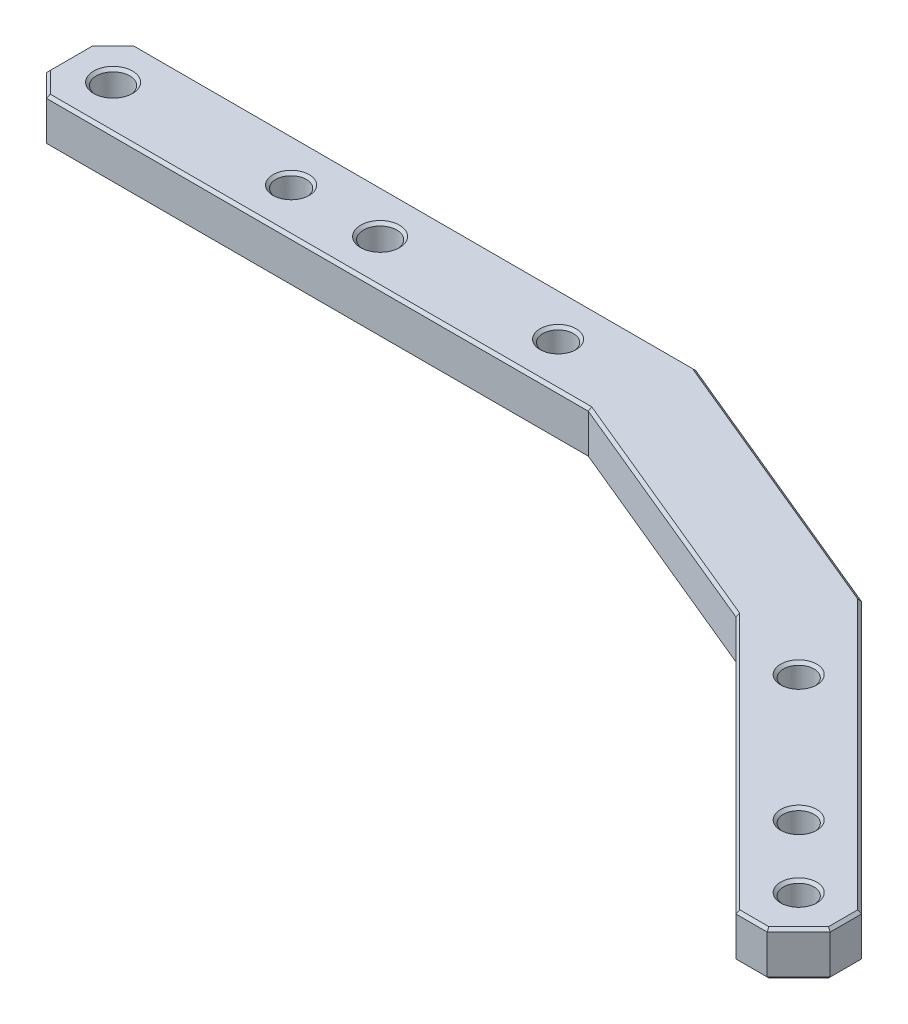
from build123d import *

# Parameters (mm, degrees)
SKETCH1_R           = 2.38125
SKETCH1_R_2         = 2.1828125
BOSS_EXTRUDE1_DEPTH = 6.35
CHAMFER1_SIZE       = 3.175
CHAMFER2_SIZE       = 0.396875


with BuildPart() as part:
    # Sketch1 → Boss-Extrude1 (new body)
    with BuildSketch(Plane(origin=(0, 0, 0), x_dir=(1, 0, 0), z_dir=(0, 1, 0))):
        Polygon((-44.45, 6.35), (62.365403734, 6.35), (119.934787808, -51.219384074), (110.954531687, -60.199640195), (57.104891492, -6.35), (-44.45, -6.35), align=None)
        with Locations(Location((-38.1, 0, 0), (0, 0, 270))):
            Circle(SKETCH1_R, mode=Mode.SUBTRACT)
        with Locations(Location((0, 0, 0), (0, 0, 270))):
            Circle(SKETCH1_R, mode=Mode.SUBTRACT)
        with Locations(Location((110.954531687, -51.219384074, 0), (0, 0, 270))):
            Circle(SKETCH1_R_2, mode=Mode.SUBTRACT)
        with Locations(Location((101.974275566, -42.239127953, 0), (0, 0, 270))):
            Circle(SKETCH1_R_2, mode=Mode.SUBTRACT)
        with Locations(Location((-12.7, 0, 0), (0, 0, 270))):
            Circle(SKETCH1_R_2, mode=Mode.SUBTRACT)
        with Locations(Location((25.4, 0, 0), (0, 0, 270))):
            Circle(SKETCH1_R_2, mode=Mode.SUBTRACT)
        with Locations(Location((84.013763324, -24.27861571, 0), (0, 0, 270))):
            Circle(SKETCH1_R_2, mode=Mode.SUBTRACT)
    extrude(amount=BOSS_EXTRUDE1_DEPTH)

    # Fillet1
    # the kernel refuses this chamfer: 50.8 mm, written as the material it adds along each edge
    with BuildSketch(Plane(origin=(57.104891492, 0, 6.35), x_dir=(0.7306772036716535, 0, 0.6827230946984092), z_dir=(0, 1, 0))) as fillet1_piece_1:
        with BuildLine():
            Line((22.93255988, 0), (-17.277556946, -15.079400804))
            Line((-17.277556946, -15.079400804), (-17.97120361, -14.337032765))
            ThreePointArc((-17.97120361, -14.337032765), (-9.066978051, -7.081424312), (-0.693646664, 0.742368039))
            Line((-0.693646664, 0.742368039), (0.034451214, 1.015415734))
            ThreePointArc((0.034451214, 1.015415734), (11.487547245, 0.626832956), (22.967011094, 1.015415734))
            Line((22.967011094, 1.015415734), (22.93255988, 0))
        make_face()
    extrude(amount=6.35)

    # Fillet2
    # the kernel refuses this chamfer: 57.15 mm, written as the material it takes off along each edge
    with BuildSketch(Plane(origin=(62.365403734, -64.497824661, -6.35), x_dir=(0.7306772036716533, 0, 0.6827230946984093), z_dir=(0, 1, 0))) as fillet2_piece_1:
        with BuildLine():
            Line((25.799129864, 0), (-19.437251564, -16.964325904))
            Line((-19.437251564, -16.964325904), (-20.217604061, -16.129161861))
            ThreePointArc((-20.217604061, -16.129161861), (-10.200350307, -7.966602351), (-0.780352497, 0.835164044))
            Line((-0.780352497, 0.835164044), (0.038757616, 1.142342701))
            ThreePointArc((0.038757616, 1.142342701), (12.923490651, 0.705187075), (25.837887481, 1.142342701))
            Line((25.837887481, 1.142342701), (25.799129864, 0))
        make_face()
    extrude(amount=135.345649322, mode=Mode.SUBTRACT)

    # Chamfer1
    chamfer1_edges = [part.edges().sort_by_distance(p)[0] for p in [
        (-44.45, 3.175, -6.35),
        (119.934787808, 3.175, 51.219384074),
        (110.954531687, 3.175, 60.199640195),
        (-44.45, 3.175, 6.35),
    ]]
    chamfer(chamfer1_edges, length=CHAMFER1_SIZE)

    # Chamfer2
    chamfer2_edges = [part.edges().sort_by_distance(p)[0] for p in [
        (0, 0, -2.38125),
        (0, 6.35, -2.38125),
        (-38.1, 0, -2.38125),
        (-38.1, 6.35, -2.38125),
        (110.954531687, 0, 49.036571574),
        (110.954531687, 6.35, 49.036571574),
        (101.974275566, 0, 40.056315453),
        (101.974275566, 6.35, 40.056315453),
        (-12.7, 0, -2.1828125),
        (-12.7, 6.35, -2.1828125),
        (25.4, 0, -2.1828125),
        (25.4, 6.35, -2.1828125),
        (84.013763324, 0, 22.09580321),
        (84.013763324, 6.35, 22.09580321),
        (90.346667332, 0, 39.59177584),
        (90.346667332, 6.35, 39.59177584),
        (54.023354766, 0, 13.789487758),
        (54.023354766, 6.35, 13.789487758),
        (-1.290950678, 0, -6.35),
        (-1.290950678, 6.35, -6.35),
        (58.898674917, 0, 2.019423728),
        (58.898674917, 6.35, 2.019423728),
        (-44.45, 0, 0),
        (-44.45, 6.35, 0),
        (98.396987484, 0, 29.681583749),
        (115.444659748, 0, 55.709512134),
        (-2.606078738, 0, 6.35),
        (117.689723778, 0, 51.219384074),
        (110.954531687, 0, 57.954576164),
        (-42.8625, 0, 4.7625),
        (-42.8625, 0, -4.7625),
        (98.396987484, 6.35, 29.681583749),
        (-2.606078738, 6.35, 6.35),
        (115.444659748, 6.35, 55.709512134),
        (117.689723778, 6.35, 51.219384074),
        (110.954531687, 6.35, 57.954576164),
        (-42.8625, 6.35, 4.7625),
        (-42.8625, 6.35, -4.7625),
    ]]
    chamfer(chamfer2_edges, length=CHAMFER2_SIZE)


solid = part.part
